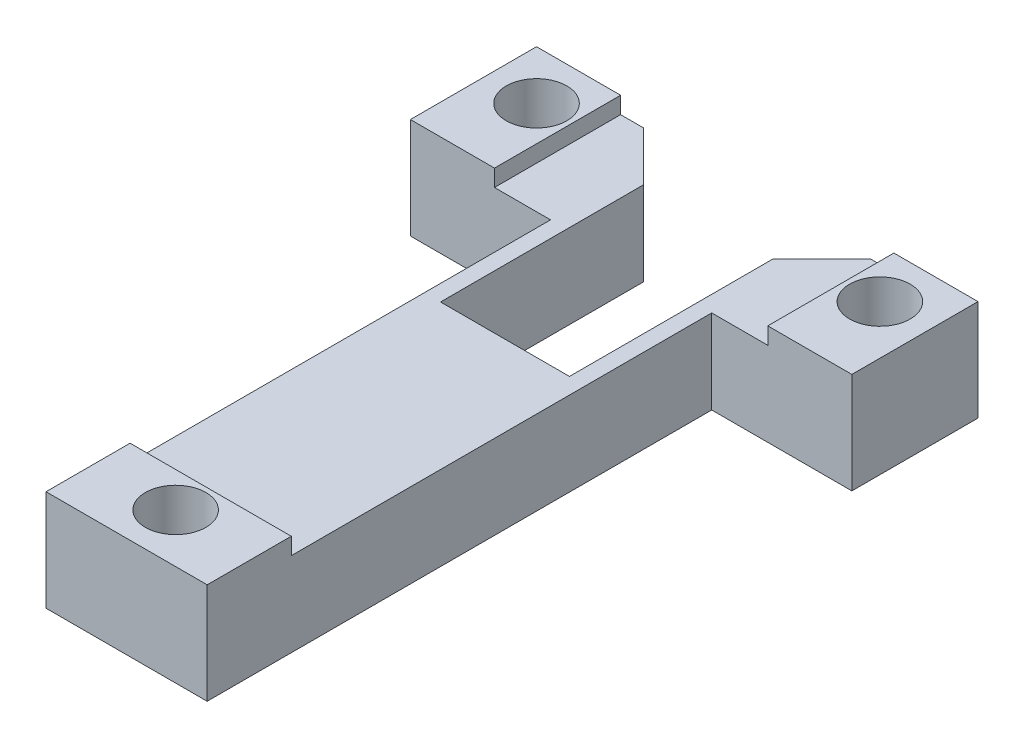
from build123d import *

# Parameters (mm, degrees)
BOSS_EXTRUDE1_DEPTH     = 6
SKETCH3_W               = 6
SKETCH3_H               = 9
SKETCH3_W_2             = 11.5
SKETCH3_H_2             = 6
BOSS_EXTRUDE2_DEPTH     = 1.2
CUT_EXTRUDE1_DEPTH      = 51.231961937
CUT_EXTRUDE1_DEPTH_BACK = 11
SKETCH2_R               = 2.16


with BuildPart() as part:
    # Sketch1 → Boss-Extrude1 (new body)
    with BuildSketch(Plane(origin=(0, 0, 0), x_dir=(1, 0, 0), z_dir=(0, 1, 0))):
        Polygon((11.5, 0), (11.5, 36), (21.5, 36), (21.5, 45), (-10, 45), (-10, 36), (0, 36), (0, 0), align=None)
    extrude(amount=BOSS_EXTRUDE1_DEPTH)

    # Sketch3 → Boss-Extrude2 (add)
    with BuildSketch(Plane(origin=(0, 6, 0), x_dir=(1, 0, 0), z_dir=(0, 1, 0))):
        with Locations((-7, 40.5)):
            Rectangle(SKETCH3_W, SKETCH3_H)
        with Locations((18.5, 40.5)):
            Rectangle(SKETCH3_W, SKETCH3_H)
        with Locations((5.75, 3)):
            Rectangle(SKETCH3_W_2, SKETCH3_H_2)
    extrude(amount=BOSS_EXTRUDE2_DEPTH)

    # Sketch2 → Cut-Extrude1 (cut, two sides: drawn at the far end of the back side and taken through both)
    with BuildSketch(Plane(origin=(0, 6, 0), x_dir=(1, 0, 0), z_dir=(0, 1, 0)).offset(-CUT_EXTRUDE1_DEPTH_BACK)):
        Polygon((1.15, 41.5), (1.15, 27), (5.75, 27), (10.35, 27), (10.35, 41.5), (13.85, 45), (-2.35, 45), align=None)
        with Locations((5.75, 3.5)):
            Circle(SKETCH2_R)
        with Locations((-6.5, 41.5)):
            Circle(SKETCH2_R)
        with Locations((18, 41.5)):
            Circle(SKETCH2_R)
    extrude(amount=CUT_EXTRUDE1_DEPTH + CUT_EXTRUDE1_DEPTH_BACK, mode=Mode.SUBTRACT)


solid = part.part
